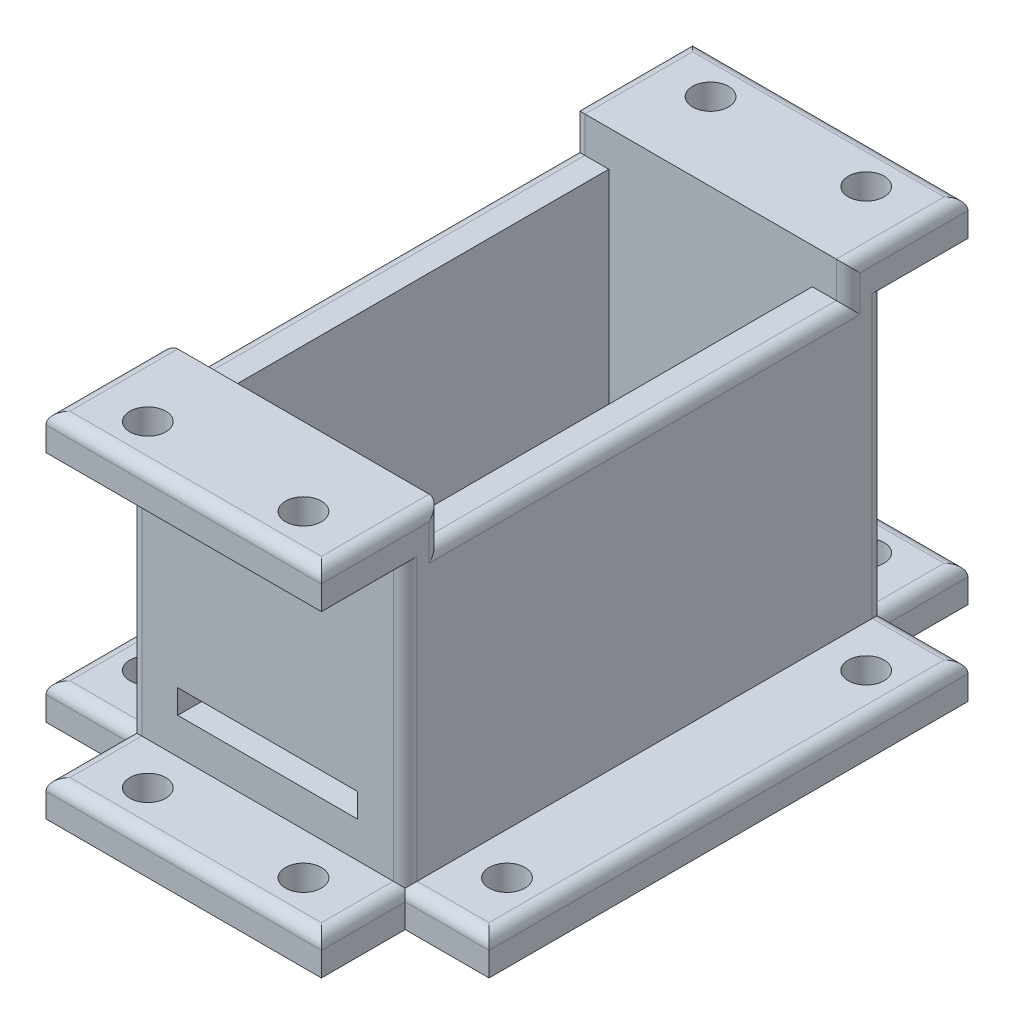
from build123d import *

# Parameters (mm, degrees)
CROQUIS2_W              = 23
CROQUIS2_H              = 40
SALIENTE_EXTRUIR1_DEPTH = 23.5
CROQUIS3_W              = 17
CROQUIS3_H              = 34
CORTAR_EXTRUIR1_DEPTH   = 13.5
CROQUIS4_W              = 13
CROQUIS4_H              = 40
CROQUIS4_W_2            = 23
CROQUIS4_H_2            = 13
SALIENTE_EXTRUIR6_DEPTH = 3
CROQUIS6_R              = 1.5
CORTAR_EXTRUIR2_DEPTH   = 61.508263898
SALIENTE_EXTRUIR7_START = 3
CROQUIS7_W              = 23
CROQUIS7_H              = 10
CROQUIS7_R              = 1.5
SALIENTE_EXTRUIR7_DEPTH = 3
REDONDEO1_R             = 1
REDONDEO2_R             = 1
REDONDEO3_R             = 1
CROQUIS8_W              = 17
CROQUIS8_H              = 34
CORTAR_EXTRUIR3_DEPTH   = 64.081296753
CROQUIS9_W              = 15
CROQUIS9_H              = 2
CORTAR_EXTRUIR4_DEPTH   = 62.735322142


with BuildPart() as part:
    # Croquis2 → Saliente-Extruir1 (new body)
    with BuildSketch(Plane(origin=(0, 0, 0), x_dir=(1, 0, 0), z_dir=(0, 1, 0))):
        with Locations((-11.5, 20)):
            Rectangle(CROQUIS2_W, CROQUIS2_H)
    extrude(amount=SALIENTE_EXTRUIR1_DEPTH)

    # Croquis3 → Cortar-Extruir1 (cut)
    with BuildSketch(Plane(origin=(0, 23.5, 0), x_dir=(1, 0, 0), z_dir=(0, 1, 0))):
        with Locations((-11.5, 20)):
            Rectangle(CROQUIS3_W, CROQUIS3_H)
    extrude(amount=-CORTAR_EXTRUIR1_DEPTH, mode=Mode.SUBTRACT)

    # Croquis4 → Saliente-Extruir6 (add)
    with BuildSketch(Plane.XZ):
        with Locations((-23.5, -20)):
            Rectangle(CROQUIS4_W, CROQUIS4_H)
        with Locations((-11.5, 0.5)):
            Rectangle(CROQUIS4_W_2, CROQUIS4_H_2)
        with Locations((0.5, -20)):
            Rectangle(CROQUIS4_W, CROQUIS4_H)
        with Locations((-11.5, -40.5)):
            Rectangle(CROQUIS4_W_2, CROQUIS4_H_2)
    extrude(amount=SALIENTE_EXTRUIR6_DEPTH)

    # Croquis6 → Cortar-Extruir2 (cut, through all)
    with BuildSketch(Plane(origin=(0, 0, 0), x_dir=(1, 0, 0), z_dir=(0, 1, 0))):
        with Locations(Location((-26.5, 5, 0), (0, 0, 270))):
            Circle(CROQUIS6_R)
        with Locations(Location((-26.5, 35, 0), (0, 0, 270))):
            Circle(CROQUIS6_R)
        with Locations(Location((-18, 43.5, 0), (0, 0, 270))):
            Circle(CROQUIS6_R)
        with Locations(Location((-5, 43.5, 0), (0, 0, 270))):
            Circle(CROQUIS6_R)
        with Locations(Location((3.5, 5, 0), (0, 0, 90))):
            Circle(CROQUIS6_R)
        with Locations(Location((3.5, 35, 0), (0, 0, 90))):
            Circle(CROQUIS6_R)
        with Locations(Location((-5, -3.5, 0), (0, 0, 90))):
            Circle(CROQUIS6_R)
        with Locations(Location((-18, -3.5, 0), (0, 0, 90))):
            Circle(CROQUIS6_R)
    extrude(amount=-CORTAR_EXTRUIR2_DEPTH, mode=Mode.SUBTRACT)

    # Croquis7 → Saliente-Extruir7 (add)
    # profile 1 of 2: a face of its own
    with BuildSketch(Plane(origin=(0, 23.5, 0), x_dir=(1, 0, 0), z_dir=(0, 1, 0)).offset(SALIENTE_EXTRUIR7_START)):
        with Locations((-11.5, 42)):
            Rectangle(CROQUIS7_W, CROQUIS7_H)
        with Locations(Location((-18, 43.5, 0), (0, 0, 270))):
            Circle(CROQUIS7_R, mode=Mode.SUBTRACT)
        with Locations(Location((-5, 43.5, 0), (0, 0, 270))):
            Circle(CROQUIS7_R, mode=Mode.SUBTRACT)
    # profile 2 of 2: a face of its own
    with BuildSketch(Plane(origin=(0, 23.5, 0), x_dir=(1, 0, 0), z_dir=(0, 1, 0)).offset(SALIENTE_EXTRUIR7_START)):
        with Locations((-11.5, -2)):
            Rectangle(CROQUIS7_W, CROQUIS7_H)
        with Locations(Location((-18, -3.5, 0), (0, 0, 90))):
            Circle(CROQUIS7_R, mode=Mode.SUBTRACT)
        with Locations(Location((-5, -3.5, 0), (0, 0, 90))):
            Circle(CROQUIS7_R, mode=Mode.SUBTRACT)
    extrude(amount=-SALIENTE_EXTRUIR7_DEPTH)

    # Redondeo1
    # the kernel refuses this fillet: 1 mm, written as the material it takes off along each edge
    with BuildSketch(Plane(origin=(-23, 0, -40), x_dir=(0, 0, 1), z_dir=(0, 1, 0)), Plane(origin=(-23, 0, 0), x_dir=(1, 0, 0), z_dir=(0, 1, 0))) as redondeo1_piece_1:
        with BuildLine():
            CenterArc((REDONDEO1_R, REDONDEO1_R), REDONDEO1_R, 180, 90)
            Line((0, REDONDEO1_R), (0, 0))
            Line((0, 0), (REDONDEO1_R, 0))
        make_face()
    extrude(amount=23.5, mode=Mode.SUBTRACT)
    with BuildSketch(Plane(origin=(0, 0, -40), x_dir=(0, 0, 1), z_dir=(0, 1, 0)), Plane(origin=(0, 0, 0), x_dir=(-1, 0, 0), z_dir=(0, 1, 0))) as redondeo1_piece_2:
        with BuildLine():
            CenterArc((REDONDEO1_R, -REDONDEO1_R), REDONDEO1_R, 90, 90)
            Line((0, -REDONDEO1_R), (0, 0))
            Line((0, 0), (REDONDEO1_R, 0))
        make_face()
    extrude(amount=23.5, mode=Mode.SUBTRACT)

    # Redondeo2
    # the kernel refuses this fillet: 1 mm, written as the material it takes off along each edge
    with BuildSketch(Plane(origin=(-30, 0, -42.5), x_dir=(1, 0, 0), z_dir=(0, 0, 1))) as redondeo2_piece_1:
        with BuildLine():
            CenterArc((REDONDEO2_R, -REDONDEO2_R), REDONDEO2_R, 90, 90)
            Line((0, -REDONDEO2_R), (0, 0))
            Line((0, 0), (REDONDEO2_R, 0))
        make_face()
    extrude(amount=45, mode=Mode.SUBTRACT)
    with BuildSketch(Plane(origin=(-32.5, 0, 0), x_dir=(0, 0, -1), z_dir=(1, 0, 0)), Plane(origin=(-23, 0, -40), x_dir=(0, 0, 1), z_dir=(-1, 0, 0)), Plane(origin=(0, 0, -40), x_dir=(-1, 0, 0), z_dir=(0, 0, -1)), Plane(origin=(-23, 0, -49.5), x_dir=(1, 0, 0), z_dir=(0, 0, 1))) as redondeo2_piece_2:
        with BuildLine():
            CenterArc((REDONDEO2_R, -REDONDEO2_R), REDONDEO2_R, 90, 90)
            Line((0, -REDONDEO2_R), (0, 0))
            Line((0, 0), (REDONDEO2_R, 0))
        make_face()
    extrude(amount=9.5, mode=Mode.SUBTRACT)
    with BuildSketch(Plane(origin=(9.5, 0, 0), x_dir=(0, 0, -1), z_dir=(-1, 0, 0)), Plane(origin=(-23, 0, 9.5), x_dir=(1, 0, 0), z_dir=(0, 0, -1)), Plane(origin=(0, 0, -40), x_dir=(0, 0, 1), z_dir=(1, 0, 0)), Plane(origin=(0, 0, 0), x_dir=(-1, 0, 0), z_dir=(0, 0, 1))) as redondeo2_piece_3:
        with BuildLine():
            CenterArc((REDONDEO2_R, REDONDEO2_R), REDONDEO2_R, 180, 90)
            Line((0, REDONDEO2_R), (0, 0))
            Line((0, 0), (REDONDEO2_R, 0))
        make_face()
    extrude(amount=9.5, mode=Mode.SUBTRACT)
    with BuildSketch(Plane(origin=(2.5, 0, 7), x_dir=(0, 0, -1), z_dir=(-1, 0, 0))) as redondeo2_piece_4:
        with BuildLine():
            CenterArc((REDONDEO2_R, REDONDEO2_R), REDONDEO2_R, 180, 90)
            Line((0, REDONDEO2_R), (0, 0))
            Line((0, 0), (REDONDEO2_R, 0))
        make_face()
    extrude(amount=28, mode=Mode.SUBTRACT)
    with BuildSketch(Plane(origin=(7, 0, -42.5), x_dir=(-1, 0, 0), z_dir=(0, 0, 1))) as redondeo2_piece_5:
        with BuildLine():
            CenterArc((REDONDEO2_R, REDONDEO2_R), REDONDEO2_R, 180, 90)
            Line((0, REDONDEO2_R), (0, 0))
            Line((0, 0), (REDONDEO2_R, 0))
        make_face()
    extrude(amount=45, mode=Mode.SUBTRACT)
    with BuildSketch(Plane(origin=(2.5, 0, -47), x_dir=(0, 0, 1), z_dir=(-1, 0, 0))) as redondeo2_piece_6:
        with BuildLine():
            CenterArc((REDONDEO2_R, -REDONDEO2_R), REDONDEO2_R, 90, 90)
            Line((0, -REDONDEO2_R), (0, 0))
            Line((0, 0), (REDONDEO2_R, 0))
        make_face()
    extrude(amount=28, mode=Mode.SUBTRACT)
    with BuildSketch(Plane(origin=(-32.5, 0, 0), x_dir=(0, 0, -1), z_dir=(1, 0, 0))) as redondeo2_piece_7a_section:
        with BuildLine():
            CenterArc((REDONDEO2_R, -REDONDEO2_R), REDONDEO2_R, 90, 90)
            Line((0, -REDONDEO2_R), (0, 0))
            Line((0, 0), (REDONDEO2_R, 0))
        make_face()
    redondeo2_piece_7a = extrude(amount=12, mode=Mode.PRIVATE)
    redondeo2_piece_7a = redondeo2_piece_7a - Plane(origin=(-22, -0.287823154, -1), x_dir=(1, 0, 0), z_dir=(0, -1, 0)) * Cylinder(1, 28, mode=Mode.PRIVATE)
    redondeo2_piece_7a = split(redondeo2_piece_7a, bisect_by=Plane(origin=(-23, -0.287823154, -0.287823154), z_dir=(1, 0, 0)), keep=Keep.TOP, mode=Mode.PRIVATE)
    with BuildSketch(Plane(origin=(-23, 0, 9.5), x_dir=(1, 0, 0), z_dir=(0, 0, -1))) as redondeo2_piece_7b_section:
        with BuildLine():
            CenterArc((REDONDEO2_R, REDONDEO2_R), REDONDEO2_R, 180, 90)
            Line((0, REDONDEO2_R), (0, 0))
            Line((0, 0), (REDONDEO2_R, 0))
        make_face()
    redondeo2_piece_7b = extrude(amount=12, mode=Mode.PRIVATE)
    redondeo2_piece_7b = split(redondeo2_piece_7b, bisect_by=Plane(origin=(-22.712176846, -0.287823154, 0), z_dir=(0, 0, -1)), keep=Keep.TOP, mode=Mode.PRIVATE)
    redondeo2_piece_7b = redondeo2_piece_7b - Plane(origin=(-22, -0.287823154, -1), x_dir=(1, 0, 0), z_dir=(0, -1, 0)) * Cylinder(1, 29, mode=Mode.PRIVATE)
    redondeo2_piece_7 = redondeo2_piece_7a & redondeo2_piece_7b
    add(redondeo2_piece_7, mode=Mode.SUBTRACT)
    with BuildSketch(Plane(origin=(-23, 0, -49.5), x_dir=(1, 0, 0), z_dir=(0, 0, 1))) as redondeo2_piece_8a_section:
        with BuildLine():
            CenterArc((REDONDEO2_R, -REDONDEO2_R), REDONDEO2_R, 90, 90)
            Line((0, -REDONDEO2_R), (0, 0))
            Line((0, 0), (REDONDEO2_R, 0))
        make_face()
    redondeo2_piece_8a = extrude(amount=12, mode=Mode.PRIVATE)
    redondeo2_piece_8a = redondeo2_piece_8a - Plane(origin=(-22, -0.287823154, -39), x_dir=(0, 0, 1), z_dir=(0, -1, 0)) * Cylinder(1, 28, mode=Mode.PRIVATE)
    redondeo2_piece_8a = split(redondeo2_piece_8a, bisect_by=Plane(origin=(-22.712176846, -0.287823154, -40), z_dir=(0, 0, 1)), keep=Keep.TOP, mode=Mode.PRIVATE)
    with BuildSketch(Plane(origin=(-20.5, 0, -40), x_dir=(0, 0, 1), z_dir=(-1, 0, 0))) as redondeo2_piece_8b_section:
        with BuildLine():
            CenterArc((REDONDEO2_R, -REDONDEO2_R), REDONDEO2_R, 90, 90)
            Line((0, -REDONDEO2_R), (0, 0))
            Line((0, 0), (REDONDEO2_R, 0))
        make_face()
    redondeo2_piece_8b = extrude(amount=12, mode=Mode.PRIVATE)
    redondeo2_piece_8b = split(redondeo2_piece_8b, bisect_by=Plane(origin=(-23, -0.287823154, -39.712176846), z_dir=(1, 0, 0)), keep=Keep.TOP, mode=Mode.PRIVATE)
    redondeo2_piece_8b = redondeo2_piece_8b - Plane(origin=(-22, -0.287823154, -39), x_dir=(0, 0, 1), z_dir=(0, -1, 0)) * Cylinder(1, 28, mode=Mode.PRIVATE)
    redondeo2_piece_8 = redondeo2_piece_8a & redondeo2_piece_8b
    add(redondeo2_piece_8, mode=Mode.SUBTRACT)
    with BuildSketch(Plane(origin=(0, 0, -2.5), x_dir=(-1, 0, 0), z_dir=(0, 0, 1))) as redondeo2_piece_9a_section:
        with BuildLine():
            CenterArc((REDONDEO2_R, REDONDEO2_R), REDONDEO2_R, 180, 90)
            Line((0, REDONDEO2_R), (0, 0))
            Line((0, 0), (REDONDEO2_R, 0))
        make_face()
    redondeo2_piece_9a = extrude(amount=12, mode=Mode.PRIVATE)
    redondeo2_piece_9a = split(redondeo2_piece_9a, bisect_by=Plane(origin=(-0.287823154, -0.287823154, 0), z_dir=(0, 0, -1)), keep=Keep.TOP, mode=Mode.PRIVATE)
    redondeo2_piece_9a = redondeo2_piece_9a - Plane(origin=(-1, -0.287823154, -1), x_dir=(-1, 0, 0), z_dir=(0, -1, 0)) * Cylinder(1, 29, mode=Mode.PRIVATE)
    with BuildSketch(Plane(origin=(9.5, 0, 0), x_dir=(0, 0, -1), z_dir=(-1, 0, 0))) as redondeo2_piece_9b_section:
        with BuildLine():
            CenterArc((REDONDEO2_R, REDONDEO2_R), REDONDEO2_R, 180, 90)
            Line((0, REDONDEO2_R), (0, 0))
            Line((0, 0), (REDONDEO2_R, 0))
        make_face()
    redondeo2_piece_9b = extrude(amount=12, mode=Mode.PRIVATE)
    redondeo2_piece_9b = split(redondeo2_piece_9b, bisect_by=Plane(origin=(0, -0.287823154, -0.287823154), z_dir=(-1, 0, 0)), keep=Keep.TOP, mode=Mode.PRIVATE)
    redondeo2_piece_9b = redondeo2_piece_9b - Plane(origin=(-1, -0.287823154, -1), x_dir=(-1, 0, 0), z_dir=(0, -1, 0)) * Cylinder(1, 28, mode=Mode.PRIVATE)
    redondeo2_piece_9 = redondeo2_piece_9a & redondeo2_piece_9b
    add(redondeo2_piece_9, mode=Mode.SUBTRACT)
    with BuildSketch(Plane(origin=(-2.5, 0, -40), x_dir=(0, 0, 1), z_dir=(1, 0, 0))) as redondeo2_piece_10a_section:
        with BuildLine():
            CenterArc((REDONDEO2_R, REDONDEO2_R), REDONDEO2_R, 180, 90)
            Line((0, REDONDEO2_R), (0, 0))
            Line((0, 0), (REDONDEO2_R, 0))
        make_face()
    redondeo2_piece_10a = extrude(amount=12, mode=Mode.PRIVATE)
    redondeo2_piece_10a = redondeo2_piece_10a - Plane(origin=(-1, -0.287823154, -39), x_dir=(0, 0, 1), z_dir=(0, -1, 0)) * Cylinder(1, 28, mode=Mode.PRIVATE)
    redondeo2_piece_10a = split(redondeo2_piece_10a, bisect_by=Plane(origin=(0, -0.287823154, -39.712176846), z_dir=(-1, 0, 0)), keep=Keep.TOP, mode=Mode.PRIVATE)
    with BuildSketch(Plane(origin=(0, 0, -37.5), x_dir=(-1, 0, 0), z_dir=(0, 0, -1))) as redondeo2_piece_10b_section:
        with BuildLine():
            CenterArc((REDONDEO2_R, -REDONDEO2_R), REDONDEO2_R, 90, 90)
            Line((0, -REDONDEO2_R), (0, 0))
            Line((0, 0), (REDONDEO2_R, 0))
        make_face()
    redondeo2_piece_10b = extrude(amount=12, mode=Mode.PRIVATE)
    redondeo2_piece_10b = split(redondeo2_piece_10b, bisect_by=Plane(origin=(-0.287823154, -0.287823154, -40), z_dir=(0, 0, 1)), keep=Keep.TOP, mode=Mode.PRIVATE)
    redondeo2_piece_10b = redondeo2_piece_10b - Plane(origin=(-1, -0.287823154, -39), x_dir=(0, 0, 1), z_dir=(0, -1, 0)) * Cylinder(1, 28, mode=Mode.PRIVATE)
    redondeo2_piece_10 = redondeo2_piece_10a & redondeo2_piece_10b
    add(redondeo2_piece_10, mode=Mode.SUBTRACT)

    # Redondeo3
    redondeo3_edges = [part.edges().sort_by_distance(p)[0] for p in [
        (0, 25, -37),
        (0, 25, -3),
        (-23, 25, -3),
        (-23, 25, -37),
        (-23, 23.5, -20),
        (0, 23.5, -20),
        (0, 26.5, 2),
        (-23, 26.5, 2),
        (-11.5, 26.5, 7),
        (0, 26.5, -42),
        (-11.5, 26.5, -47),
        (-23, 26.5, -42),
    ]]
    fillet(redondeo3_edges, radius=REDONDEO3_R)

    # Croquis8 → Cortar-Extruir3 (cut, through all)
    with BuildSketch(Plane(origin=(0, -3, 0), x_dir=(-1, 0, 0), z_dir=(0, -1, 0))):
        with Locations((11.5, 20)):
            Rectangle(CROQUIS8_W, CROQUIS8_H)
    extrude(amount=-CORTAR_EXTRUIR3_DEPTH, mode=Mode.SUBTRACT)

    # Croquis9 → Cortar-Extruir4 (cut, through all)
    with BuildSketch(Plane(origin=(0, 0, -40), x_dir=(-1, 0, 0), z_dir=(0, 0, -1))):
        with Locations((11.5, 4)):
            Rectangle(CROQUIS9_W, CROQUIS9_H)
    extrude(amount=-CORTAR_EXTRUIR4_DEPTH, mode=Mode.SUBTRACT)


solid = part.part
